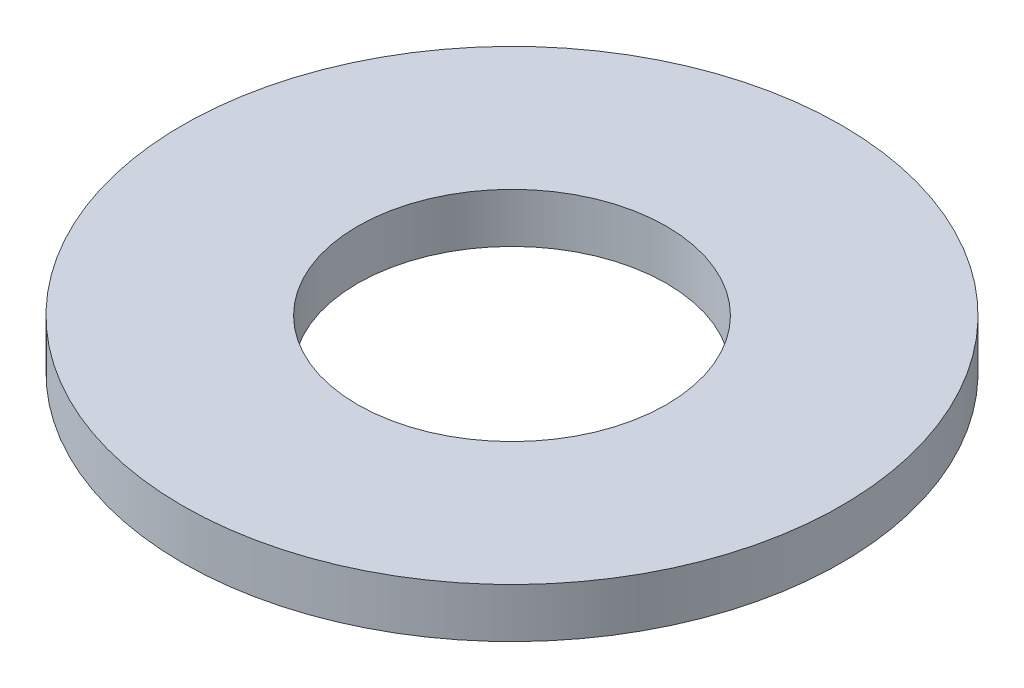
from build123d import *

# Parameters (mm, degrees)
SKETCH1_R           = 80
BOSS_EXTRUDE1_DEPTH = 12
SKETCH2_R           = 37.5
CUT_EXTRUDE1_DEPTH  = 114.771701227


with BuildPart() as part:
    # Sketch1 → Boss-Extrude1 (new body)
    with BuildSketch(Plane(origin=(0, 0, 0), x_dir=(1, 0, 0), z_dir=(0, 1, 0))):
        Circle(SKETCH1_R)
    extrude(amount=BOSS_EXTRUDE1_DEPTH)

    # Sketch2 → Cut-Extrude1 (cut, through all)
    with BuildSketch(Plane(origin=(0, 0, 0), x_dir=(1, 0, 0), z_dir=(0, 1, 0))):
        Circle(SKETCH2_R)
    extrude(amount=CUT_EXTRUDE1_DEPTH, mode=Mode.SUBTRACT)


solid = part.part
